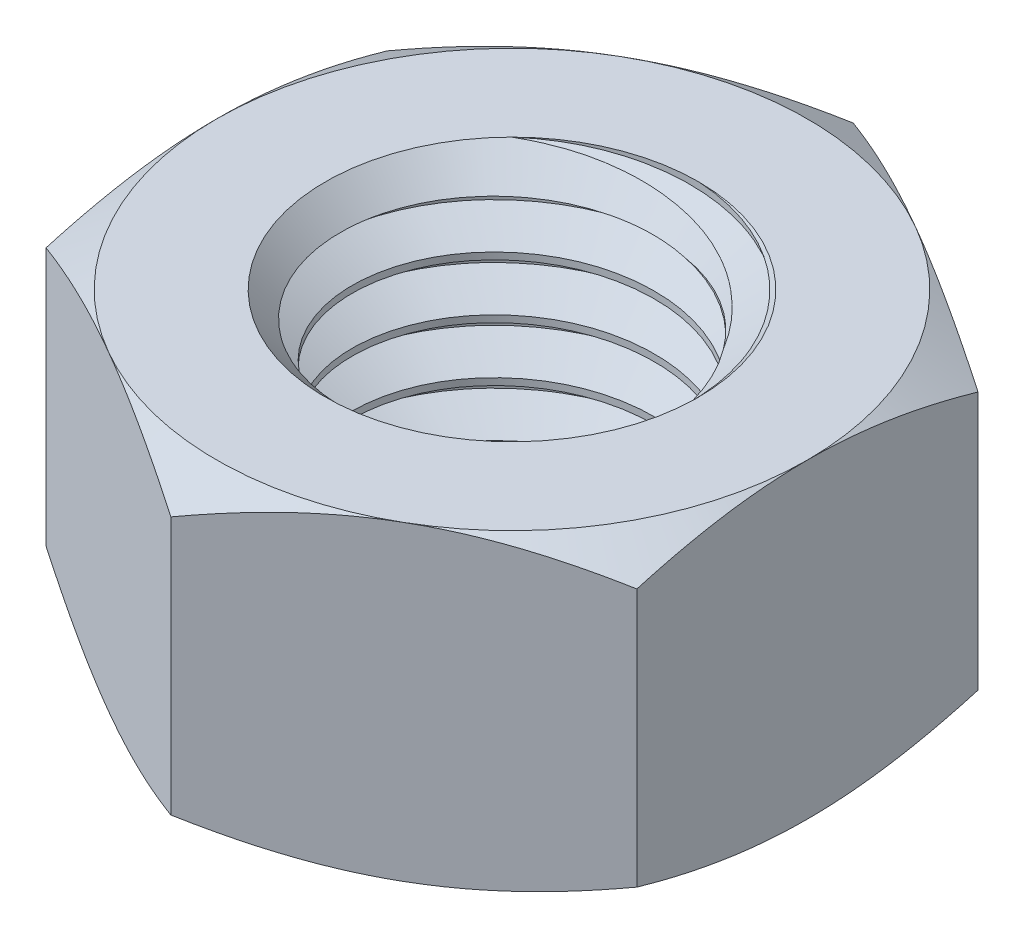
from build123d import *

# Parameters (mm, degrees)
SKETCH1_R               = 6
BOSS_EXTRUDE1_DEPTH     = 5
SKETCH5_OUTSIDE_W       = 91.652
SKETCH5_OUTSIDE_H       = 94.592
SKETCH5_OUTSIDE_R       = 9.5
CUT_EXTRUDE2_DEPTH      = 18.62337463
CUT_EXTRUDE2_DRAFT      = -60
MIRROR1_COPY_1_SKETCH_W = 91.652
MIRROR1_COPY_1_SKETCH_H = 94.592
MIRROR1_COPY_1_SKETCH_R = 9.5
MIRROR1_COPY_1_DEPTH    = 18.62337463
MIRROR1_COPY_1_DRAFT    = -60
SWEEP1_PITCH            = 1.75
CUT_EXTRUDE3_DEPTH      = 17.004629795
CUT_EXTRUDE3_DEPTH_BACK = 17.004629795
SKETCH9_W               = 19
SKETCH9_H               = 5


with BuildPart() as part:
    # Sketch1 → Boss-Extrude1 (new, symmetric)
    with BuildSketch(Plane(origin=(0, 0, 0), x_dir=(1, 0, 0), z_dir=(0, 1, 0))):
        Polygon((-9.5, 5.484827557), (-9.5, -5.484827557), (0, -10.969655115), (9.5, -5.484827557), (9.5, 5.484827557), (0, 10.969655115), align=None)
        with Locations(Location((0, 0, 0), (0, 0, 270))):
            Circle(SKETCH1_R, mode=Mode.SUBTRACT)
    extrude(amount=BOSS_EXTRUDE1_DEPTH, both=True)


with BuildPart() as cut_extrude2_tool:
    # Sketch5 outside → Cut-Extrude2 (with draft: the straight prism first)
    with BuildSketch(Plane(origin=(0, 5, 0), x_dir=(1, 0, 0), z_dir=(0, 1, 0))):
        Rectangle(SKETCH5_OUTSIDE_W, SKETCH5_OUTSIDE_H)
        Circle(SKETCH5_OUTSIDE_R, mode=Mode.SUBTRACT)
    extrude(amount=-CUT_EXTRUDE2_DEPTH)
    # Cut-Extrude2: the draft: its side faces are tilted about the plane it starts from
    cut_extrude2_sides = [cut_extrude2_tool.faces().sort_by_distance(p)[0] for p in [
        (0, -4.311687315, 47.296),
        (45.826, -4.311687315, 0),
        (0, -4.311687315, -47.296),
        (-45.826, -4.311687315, 0),
        (-9.5, -4.311687315, 0),
    ]]
    draft(cut_extrude2_sides, Plane(origin=(0, 5, 0), x_dir=(1, 0, 0), z_dir=(0, 1, 0)), CUT_EXTRUDE2_DRAFT)


with BuildPart() as part_1:
    add(part.part)

    # Cut-Extrude2: cut by cut_extrude2_tool
    add(cut_extrude2_tool.part, mode=Mode.SUBTRACT)


with BuildPart() as mirror1_copy_1_tool:
    # Mirror1 copy 1 sketch → Mirror1 copy 1 (with draft: the straight prism first)
    with BuildSketch(Plane.XZ.offset(5)):
        Rectangle(MIRROR1_COPY_1_SKETCH_W, MIRROR1_COPY_1_SKETCH_H)
        Circle(MIRROR1_COPY_1_SKETCH_R, mode=Mode.SUBTRACT)
    extrude(amount=-MIRROR1_COPY_1_DEPTH)
    # Mirror1 copy 1: the draft: its side faces are tilted about the plane it starts from
    mirror1_copy_1_sides = [mirror1_copy_1_tool.faces().sort_by_distance(p)[0] for p in [
        (0, 4.311687315, 47.296),
        (45.826, 4.311687315, 0),
        (0, 4.311687315, -47.296),
        (-45.826, 4.311687315, 0),
        (-9.5, 4.311687315, 0),
    ]]
    draft(mirror1_copy_1_sides, Plane.XZ.offset(5), MIRROR1_COPY_1_DRAFT)


with BuildPart() as part_2:
    add(part_1.part)

    # Mirror1 copy 1: cut by mirror1_copy_1_tool
    add(mirror1_copy_1_tool.part, mode=Mode.SUBTRACT)

    # Sweep1: the profile of Sketch3 profile screwed along a right-hand helix of 6.714286 turns, 10 arcs to a turn; built about Z, then put on its axis
    sweep1_z = Axis((0, 0, 0), (0, 0, 1))
    sweep1_corners = [(4.863341658, 0, -0.875), (6.0003, 0, -1.531423205), (6.0003, 0, 0.000173205), (4.863341658, 0, -0.65625)]
    with BuildLine(mode=Mode.PRIVATE) as sweep1_profile:
        Line(sweep1_corners[0], sweep1_corners[1])
        Line(sweep1_corners[1], sweep1_corners[2])
        Line(sweep1_corners[2], sweep1_corners[3])
        Line(sweep1_corners[3], sweep1_corners[0])
    sweep1_cap = Face(sweep1_profile.wire())
    sweep1_turn_angles = [0, 18, 36, 54, 72, 90, 108, 126, 144, 162, 180, 198, 216, 234, 252, 270, 288, 306, 324, 342, 360]
    sweep1_turn_weights = [1, 0.9510565162951535, 1, 0.9510565162951535, 1, 0.9510565162951535, 1, 0.9510565162951535, 1, 0.9510565162951535, 1, 0.9510565162951535, 1, 0.9510565162951535, 1, 0.9510565162951535, 1, 0.9510565162951535, 1, 0.9510565162951535, 1]
    sweep1_turn_rails = [Edge.make_bspline([Vector(p[0], p[1], 0).rotate(sweep1_z, sweep1_turn_angles[k]) / sweep1_turn_weights[k] + Vector(0, 0, p[2] + SWEEP1_PITCH * sweep1_turn_angles[k] / 360) for k in range(21)], [0, 0, 0, 1, 1, 2, 2, 3, 3, 4, 4, 5, 5, 6, 6, 7, 7, 8, 8, 9, 9, 10, 10, 10], 2, sweep1_turn_weights) for p in sweep1_corners]
    sweep1_turn_sides = [Face.make_surface_from_curves(sweep1_turn_rails[p[0]], sweep1_turn_rails[p[1]]) for p in [(0, 1), (1, 2), (2, 3), (3, 0)]]
    sweep1_last_angles = [2160, 2178, 2196, 2214, 2232, 2250, 2268, 2286, 2304, 2322, 2340, 2358, 2376, 2394, 2412, 2414.571428571, 2417.142857143]
    sweep1_last_weights = [1, 0.9510565162951535, 1, 0.9510565162951535, 1, 0.9510565162951535, 1, 0.9510565162951535, 1, 0.9510565162951535, 1, 0.9510565162951535, 1, 0.9510565162951535, 1, 0.9989930665413128, 1]
    sweep1_last_rails = [Edge.make_bspline([Vector(p[0], p[1], 0).rotate(sweep1_z, sweep1_last_angles[k]) / sweep1_last_weights[k] + Vector(0, 0, p[2] + SWEEP1_PITCH * sweep1_last_angles[k] / 360) for k in range(17)], [0, 0, 0, 1, 1, 2, 2, 3, 3, 4, 4, 5, 5, 6, 6, 7, 7, 8, 8, 8], 2, sweep1_last_weights) for p in sweep1_corners]
    sweep1_last_sides = [Face.make_surface_from_curves(sweep1_last_rails[p[0]], sweep1_last_rails[p[1]]) for p in [(0, 1), (1, 2), (2, 3), (3, 0)]]
    sweep1 = Plane(origin=(0, 5, 0), x_dir=(0, 0, -1), z_dir=(0, -1, 0)) * Solid(Shell([*[p.moved(Location((0, 0, SWEEP1_PITCH * i))) for i in range(6) for p in sweep1_turn_sides], *sweep1_last_sides, sweep1_cap, sweep1_cap.rotate(sweep1_z, 2417.142857143).moved(Location((0, 0, SWEEP1_PITCH * 2417.142857143 / 360)))]))
    add(sweep1)

    # Sketch9 → Cut-Extrude3 (cut, two sides: drawn at the far end of the back side and taken through both)
    with BuildSketch(Plane(origin=(0, 0, 0), x_dir=(0, 0, -1), z_dir=(1, 0, 0)).offset(-CUT_EXTRUDE3_DEPTH_BACK)):
        with Locations((0, 7.5)):
            Rectangle(SKETCH9_W, SKETCH9_H)
        with Locations((0, -7.5)):
            Rectangle(SKETCH9_W, SKETCH9_H)
    extrude(amount=CUT_EXTRUDE3_DEPTH + CUT_EXTRUDE3_DEPTH_BACK, mode=Mode.SUBTRACT)

    # Sketch10 → Cut-Revolve1 (revolve, cut)
    with BuildSketch(Plane(origin=(0, 0, 0), x_dir=(0, 0, -1), z_dir=(1, 0, 0))):
        Polygon((6, 5), (4.863341658, 5), (4.863341658, 3.863341658), align=None)
        Polygon((4.863341658, -5), (4.863341658, -3.863341658), (6, -5), align=None)
    revolve(axis=Axis((0, -5, 0), (0, 1, 0)), mode=Mode.SUBTRACT)


solid = part_2.part
